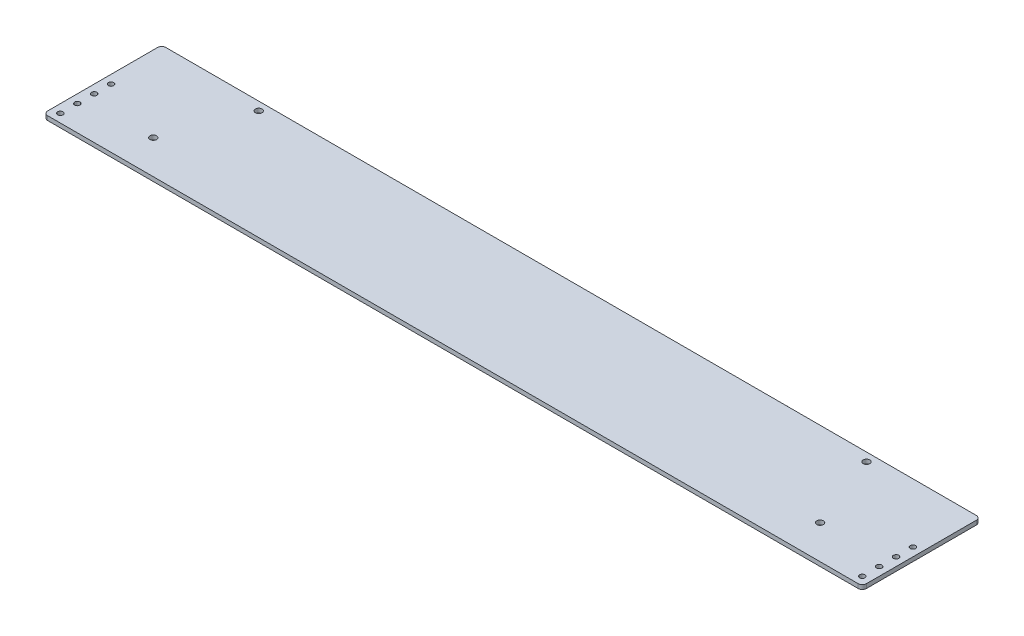
from build123d import *

# Parameters (mm, degrees)
SKETCH1_W           = 615.95
SKETCH1_H           = 88.9
SKETCH1_R           = 2.0193
BOSS_EXTRUDE1_DEPTH = 3.175
FILLET1_R           = 3.175
SKETCH2_R           = 2.4892
CUT_EXTRUDE1_DEPTH  = 312.182396273


with BuildPart() as part:
    # Sketch1 → Boss-Extrude1 (new body)
    with BuildSketch(Plane(origin=(0, 0, 0), x_dir=(1, 0, 0), z_dir=(0, 1, 0))):
        Rectangle(SKETCH1_W, SKETCH1_H)
        with Locations((-301.625, 0)):
            Circle(SKETCH1_R, mode=Mode.SUBTRACT)
        with Locations((-301.625, -12.7)):
            Circle(SKETCH1_R, mode=Mode.SUBTRACT)
        with Locations((-301.625, -25.4)):
            Circle(SKETCH1_R, mode=Mode.SUBTRACT)
        with Locations((-301.625, -38.1)):
            Circle(SKETCH1_R, mode=Mode.SUBTRACT)
        with Locations((301.625, -38.1)):
            Circle(SKETCH1_R, mode=Mode.SUBTRACT)
        with Locations((301.625, -25.4)):
            Circle(SKETCH1_R, mode=Mode.SUBTRACT)
        with Locations((301.625, -12.7)):
            Circle(SKETCH1_R, mode=Mode.SUBTRACT)
        with Locations((301.625, 0)):
            Circle(SKETCH1_R, mode=Mode.SUBTRACT)
    extrude(amount=BOSS_EXTRUDE1_DEPTH)

    # Fillet1
    fillet1_edges = [part.edges().sort_by_distance(p)[0] for p in [
        (307.975, 1.5875, 44.45),
        (-307.975, 1.5875, -44.45),
        (307.975, 1.5875, -44.45),
        (-307.975, 1.5875, 44.45),
    ]]
    fillet(fillet1_edges, radius=FILLET1_R)

    # Sketch2 → Cut-Extrude1 (cut, through all)
    with BuildSketch(Plane(origin=(0, 3.175, 0), x_dir=(1, 0, 0), z_dir=(0, 1, 0))):
        with Locations((-228.6, 38.1)):
            Circle(SKETCH2_R)
        with Locations((-250.825, -19.05)):
            Circle(SKETCH2_R)
        with Locations((250.825, -19.05)):
            Circle(SKETCH2_R)
        with Locations((228.6, 38.1)):
            Circle(SKETCH2_R)
    extrude(amount=-CUT_EXTRUDE1_DEPTH, mode=Mode.SUBTRACT)


solid = part.part
